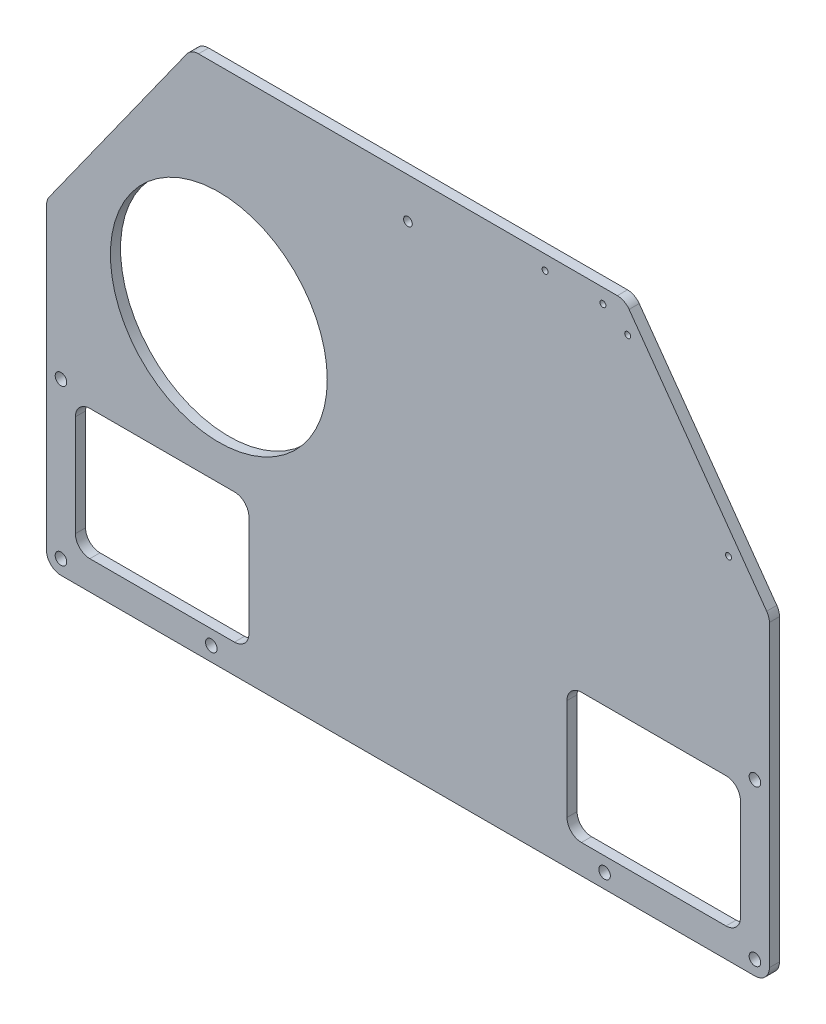
from build123d import *

# Parameters (mm, degrees)
BOSS_EXTRU_1_DEPTH           = 3.5
ESQUISSE2_R                  = 2
ENL_V_MAT_EXTRU_1_DEPTH      = 395.382111663
ESQUISSE3_R                  = 2
ENL_V_MAT_EXTRU_2_DEPTH      = 395.382111663
ENL_V_MAT_EXTRU_3_DEPTH      = 395.382111663
ENL_V_MAT_EXTRU_4_DEPTH      = 395.382111663
ENL_V_MAT_EXTRU_4_DEPTH_BACK = 395.382111663
ESQUISSE6_R                  = 1.5
ENL_V_MAT_EXTRU_5_DEPTH      = 309.078317965
CONG_1_R                     = 5
ESQUISSE7_R                  = 37.5
ENL_V_MAT_EXTRU_6_DEPTH      = 309.078317965
ESQUISSE8_R                  = 1.025
ENL_V_MAT_EXTRU_7_DEPTH      = 309.078317965


with BuildPart() as part:
    # Esquisse1 → Boss.-Extru.1 (new body)
    with BuildSketch(Plane.XY):
        with BuildLine():
            Line((5, 0), (245, 0))
            ThreePointArc((245, 0), (248.535533906, 1.464466094), (250, 5))
            Line((250, 5), (250, 305))
            Line((250, 305), (0, 305))
            Line((0, 305), (0, 5))
            ThreePointArc((0, 5), (1.464466094, 1.464466094), (5, 0))
        make_face()
    extrude(amount=BOSS_EXTRU_1_DEPTH)

    # Esquisse2 → Enlèv. mat.-Extru.1 (cut, through all)
    with BuildSketch(Plane.XY.offset(3.5)):
        with Locations((5, 5)):
            Circle(ESQUISSE2_R)
        with Locations((245, 5)):
            Circle(ESQUISSE2_R)
        with Locations((5, 58.8)):
            Circle(ESQUISSE2_R)
        with Locations((245, 58.8)):
            Circle(ESQUISSE2_R)
    extrude(amount=-ENL_V_MAT_EXTRU_1_DEPTH, mode=Mode.SUBTRACT)

    # Esquisse3 → Enlèv. mat.-Extru.2 (cut, through all)
    with BuildSketch(Plane.XY.offset(3.5)):
        with Locations((57, 5)):
            Circle(ESQUISSE3_R)
        with Locations((193, 5)):
            Circle(ESQUISSE3_R)
    extrude(amount=-ENL_V_MAT_EXTRU_2_DEPTH, mode=Mode.SUBTRACT)

    # Esquisse4 → Enlèv. mat.-Extru.3 (cut, through all)
    with BuildSketch(Plane(origin=(0, 0, 0), x_dir=(-1, 0, 0), z_dir=(0, 0, -1))):
        with BuildLine():
            Line((-70, 15), (-70, 50))
            ThreePointArc((-70, 50), (-68.535533906, 53.535533906), (-65, 55))
            Line((-65, 55), (-15, 55))
            ThreePointArc((-15, 55), (-11.464466094, 53.535533906), (-10, 50))
            Line((-10, 50), (-10, 15))
            ThreePointArc((-10, 15), (-11.464466094, 11.464466094), (-15, 10))
            Line((-15, 10), (-65, 10))
            ThreePointArc((-65, 10), (-68.535533906, 11.464466094), (-70, 15))
        make_face()
        with BuildLine():
            Line((-185, 10), (-235, 10))
            ThreePointArc((-235, 10), (-238.535533906, 11.464466094), (-240, 15))
            Line((-240, 15), (-240, 50))
            ThreePointArc((-240, 50), (-238.535533906, 53.535533906), (-235, 55))
            Line((-235, 55), (-185, 55))
            ThreePointArc((-185, 55), (-181.464466094, 53.535533906), (-180, 50))
            Line((-180, 50), (-180, 15))
            ThreePointArc((-180, 15), (-181.464466094, 11.464466094), (-185, 10))
        make_face()
    extrude(amount=-ENL_V_MAT_EXTRU_3_DEPTH, mode=Mode.SUBTRACT)

    # Esquisse5 → Enlèv. mat.-Extru.4 (cut, two sides: drawn at the far end of the back side and taken through both)
    with BuildSketch(Plane.XY.offset(3.5).offset(-ENL_V_MAT_EXTRU_4_DEPTH_BACK)):
        Polygon((-374.383398967, -414.136758554), (0, 110), (50, 180), (200, 180), (250, 110), (624.383398967, -414.136758554), (624.383398967, 874.090350445), (-374.383398967, 874.090350445), align=None)
    extrude(amount=ENL_V_MAT_EXTRU_4_DEPTH + ENL_V_MAT_EXTRU_4_DEPTH_BACK, mode=Mode.SUBTRACT)

    # Esquisse6 → Enlèv. mat.-Extru.5 (cut, through all)
    with BuildSketch(Plane.XY.offset(3.5)):
        with Locations((125, 166)):
            Circle(ESQUISSE6_R)
    extrude(amount=-ENL_V_MAT_EXTRU_5_DEPTH, mode=Mode.SUBTRACT)

    # Congé1
    cong_1_edges = [part.edges().sort_by_distance(p)[0] for p in [
        (250, 110, 1.75),
        (200, 180, 1.75),
        (50, 180, 1.75),
        (0, 110, 1.75),
    ]]
    fillet(cong_1_edges, radius=CONG_1_R)

    # Esquisse7 → Enlèv. mat.-Extru.6 (cut, through all)
    with BuildSketch(Plane.XY.offset(3.5)):
        with Locations((59.6, 104.646798594)):
            Circle(ESQUISSE7_R)
    extrude(amount=-ENL_V_MAT_EXTRU_6_DEPTH, mode=Mode.SUBTRACT)

    # Esquisse8 → Enlèv. mat.-Extru.7 (cut, through all)
    with BuildSketch(Plane.XY.offset(3.5)):
        with Locations((192.426910524, 175)):
            Circle(ESQUISSE8_R)
        with Locations((172.426910524, 175)):
            Circle(ESQUISSE8_R)
        with Locations((235.872630718, 121.175991728)):
            Circle(ESQUISSE8_R)
        with Locations((200.998339095, 170)):
            Circle(ESQUISSE8_R)
    extrude(amount=-ENL_V_MAT_EXTRU_7_DEPTH, mode=Mode.SUBTRACT)


solid = part.part
